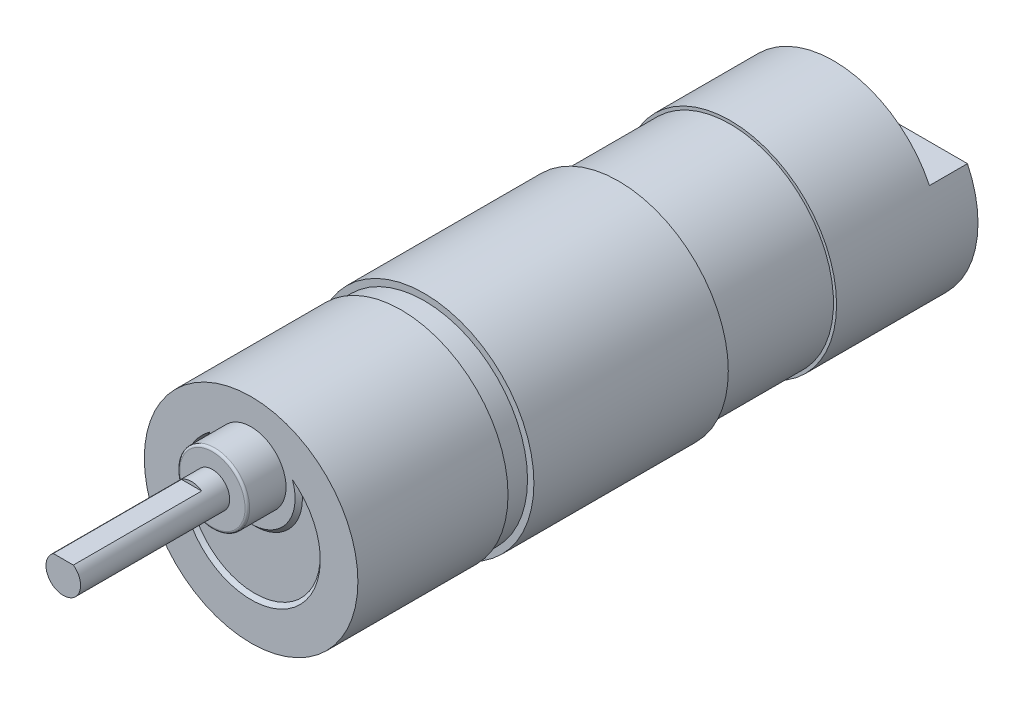
from build123d import *

# Parameters (mm, degrees)
SKETCH1_R            = 18.5039
GEARBOX_DEPTH        = 26.0096
SKETCH2_R            = 17.8943
BOSS_EXTRUDE2_DEPTH  = 56.9976
SKETCH3_R            = 18.9992
WRAP_DEPTH           = 33.6804
SKETCH4_R            = 18.4277
BOSS_EXTRUDE4_DEPTH  = 24.501601563
CONNECTDOR_START     = -6.5786
CONNECTDOR_CUT_DEPTH = 6.5786
SKETCH6_R            = 11.9888
CENTER_DISH_DEPTH    = 0.635
SKETCH7_R            = 7.62
BOSS_EXTRUDE5_DEPTH  = 0.635
CHAMFER4_SIZE        = 0.635
CHAMFER5_SIZE        = 0.635
SKETCH8_R            = 6.05155
SHAFT_COLLAR_DEPTH   = 6.7056
FILLET1_R            = 0.396875
SKETCH9_R            = 2.9972
BOSS_EXTRUDE7_DEPTH  = 25.8318
CUT_EXTRUDE3_START   = -22.225
CUT_EXTRUDE3_DEPTH   = 22.225


with BuildPart() as part:
    # Sketch1 → Gearbox (new body)
    with BuildSketch(Plane.XY):
        Circle(SKETCH1_R)
    extrude(amount=-GEARBOX_DEPTH)

    # Sketch2 → Boss-Extrude2 (add)
    with BuildSketch(Plane(origin=(0, 0, -26.0096), x_dir=(-1, 0, 0), z_dir=(0, 0, -1))):
        with Locations(Location((0, 0, 0), (0, 0, 180))):
            Circle(SKETCH2_R)
    extrude(amount=BOSS_EXTRUDE2_DEPTH)

    # Sketch3 → Wrap (add)
    with BuildSketch(Plane(origin=(0, 0, -29.9974), x_dir=(-1, 0, 0), z_dir=(0, 0, -1))):
        Circle(SKETCH3_R)
    extrude(amount=WRAP_DEPTH)

    # Sketch4 → Boss-Extrude4 (add)
    with BuildSketch(Plane(origin=(0, 0, -83.0072), x_dir=(-1, 0, 0), z_dir=(0, 0, -1))):
        with Locations(Location((0, 0, 0), (0, 0, 180))):
            Circle(SKETCH4_R)
    extrude(amount=BOSS_EXTRUDE4_DEPTH)

    # Connector → Connectdor Cut (cut)
    with BuildSketch(Plane(origin=(0, 0, -107.508801563), x_dir=(-1, 0, 0), z_dir=(0, 0, -1)).offset(CONNECTDOR_START)):
        with BuildLine():
            Line((0, 8.001), (16.600124285, 8.001))
            ThreePointArc((16.600124285, 8.001), (0, 18.4277), (-16.600124285, 8.001))
            Line((-16.600124285, 8.001), (0, 8.001))
        make_face()
    extrude(amount=CONNECTDOR_CUT_DEPTH, mode=Mode.SUBTRACT)

    # Sketch6 → Center DIsh (cut)
    with BuildSketch(Plane.XY):
        Circle(SKETCH6_R)
    extrude(amount=-CENTER_DISH_DEPTH, mode=Mode.SUBTRACT)

    # Sketch7 → Boss-Extrude5 (add)
    with BuildSketch(Plane.XY.offset(-0.635)):
        with Locations((0, 7.0104)):
            Circle(SKETCH7_R)
    extrude(amount=BOSS_EXTRUDE5_DEPTH)

    # Chamfer4
    chamfer4_edges = [part.edges().sort_by_distance(p)[0] for p in [
        (0, -0.6096, -0.635),
    ]]
    chamfer(chamfer4_edges, length=CHAMFER4_SIZE - 0.0001)  # a hair under: the kernel refuses the full size

    # Chamfer5
    chamfer5_edges = [part.edges().sort_by_distance(p)[0] for p in [
        (0, -11.9888, -0.635),
    ]]
    chamfer(chamfer5_edges, length=CHAMFER5_SIZE - 0.0001)  # a hair under: the kernel refuses the full size

    # Sketch8 → Shaft Collar (add)
    with BuildSketch(Plane.XY):
        with Locations((0, 7.92156223)):
            Circle(SKETCH8_R)
    extrude(amount=SHAFT_COLLAR_DEPTH)

    # Fillet1
    fillet1_edges = [part.edges().sort_by_distance(p)[0] for p in [
        (-6.05155, 7.92156223, 6.7056),
    ]]
    fillet(fillet1_edges, radius=FILLET1_R)

    # Sketch9 → Boss-Extrude7 (add)
    with BuildSketch(Plane.XY.offset(6.7056)):
        with Locations((0, 7.92156223)):
            Circle(SKETCH9_R)
    extrude(amount=BOSS_EXTRUDE7_DEPTH)

    # Sketch10 → Cut-Extrude3 (cut)
    with BuildSketch(Plane.XY.offset(32.5374).offset(CUT_EXTRUDE3_START)):
        with BuildLine():
            Line((0, 10.35996223), (-1.742817627, 10.35996223))
            ThreePointArc((-1.742817627, 10.35996223), (0, 10.91876223), (1.742817627, 10.35996223))
            Line((1.742817627, 10.35996223), (0, 10.35996223))
        make_face()
    extrude(amount=CUT_EXTRUDE3_DEPTH, mode=Mode.SUBTRACT)


solid = part.part
